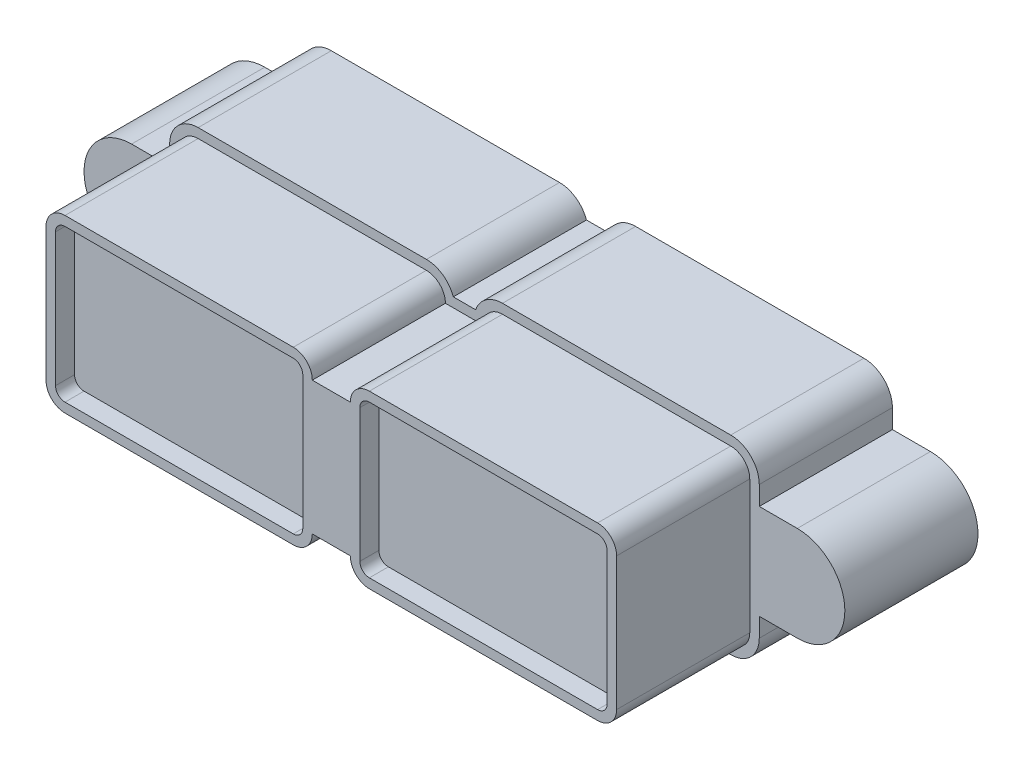
from build123d import *

# Parameters (mm, degrees)
SKETCH1_W           = 45
SKETCH1_H           = 37.5
BOSS_EXTRUDE1_DEPTH = 2
SKETCH2_W           = 40
SKETCH2_H           = 13
BOSS_EXTRUDE2_DEPTH = 7
BOSS_EXTRUDE3_DEPTH = 7
FILLET1_R           = 1
CUT_EXTRUDE1_DEPTH  = 1
SKETCH5_W           = 41
SKETCH5_H           = 14
CUT_EXTRUDE2_DEPTH  = 7
SKETCH6_W           = 11
SKETCH6_H           = 20
BOSS_EXTRUDE5_DEPTH = 12
SKETCH7_W           = 9
SKETCH7_H           = 9
CUT_EXTRUDE3_DEPTH  = 12
SKETCH8_W           = 132.830335996
SKETCH8_H           = 96.675499104
CUT_EXTRUDE4_DEPTH  = 20


with BuildPart() as part:
    # Sketch1 → Boss-Extrude1 (new body)
    with BuildSketch(Plane.XY):
        Rectangle(SKETCH1_W, SKETCH1_H)
    extrude(amount=BOSS_EXTRUDE1_DEPTH)

    # Sketch2 → Boss-Extrude2 (add)
    with BuildSketch(Plane.XY.offset(2)):
        with Locations((0, -11.25)):
            Rectangle(SKETCH2_W, SKETCH2_H)
    extrude(amount=BOSS_EXTRUDE2_DEPTH)

    # Sketch3 → Boss-Extrude3 (add)
    with BuildSketch(Plane.XY.offset(9)):
        Polygon((-1, -7.75), (-1, -6.75), (-15, -6.75), (-15, -15.75), (-1, -15.75), (-1, -14.75), (1, -14.75), (1, -15.75), (15, -15.75), (15, -6.75), (1, -6.75), (1, -7.75), align=None)
    extrude(amount=BOSS_EXTRUDE3_DEPTH)

    # Fillet1
    fillet1_edges = [part.edges().sort_by_distance(p)[0] for p in [
        (-15, -15.75, 12.5),
        (-1, -15.75, 12.5),
        (1, -15.75, 12.5),
        (-15, -6.75, 12.5),
        (15, -15.75, 12.5),
        (15, -6.75, 12.5),
        (1, -6.75, 12.5),
        (-1, -6.75, 12.5),
    ]]
    fillet(fillet1_edges, radius=FILLET1_R - 0.0001)  # a hair under: the kernel refuses the full size

    # Sketch4 → Cut-Extrude1 (cut)
    with BuildSketch(Plane.XY.offset(16)):
        with BuildLine():
            Line((-1.5, -14.75), (-1.5, -7.75))
            ThreePointArc((-1.5, -7.75), (-1.646446609, -7.396446609), (-2, -7.25))
            Line((-2, -7.25), (-14, -7.25))
            ThreePointArc((-14, -7.25), (-14.353553391, -7.396446609), (-14.5, -7.75))
            Line((-14.5, -7.75), (-14.5, -14.75))
            ThreePointArc((-14.5, -14.75), (-14.353553391, -15.103553391), (-14, -15.25))
            Line((-14, -15.25), (-2, -15.25))
            ThreePointArc((-2, -15.25), (-1.646446609, -15.103553391), (-1.5, -14.75))
        make_face()
        with BuildLine():
            Line((1.5, -7.75), (1.5, -14.75))
            ThreePointArc((1.5, -14.75), (1.646446609, -15.103553391), (2, -15.25))
            Line((2, -15.25), (14, -15.25))
            ThreePointArc((14, -15.25), (14.353553391, -15.103553391), (14.5, -14.75))
            Line((14.5, -14.75), (14.5, -7.75))
            ThreePointArc((14.5, -7.75), (14.353553391, -7.396446609), (14, -7.25))
            Line((14, -7.25), (2, -7.25))
            ThreePointArc((2, -7.25), (1.646446609, -7.396446609), (1.5, -7.75))
        make_face()
    extrude(amount=-CUT_EXTRUDE1_DEPTH, mode=Mode.SUBTRACT)

    # Sketch5 → Cut-Extrude2 (cut)
    with BuildSketch(Plane.XY.offset(9)):
        with Locations((0, -11.25)):
            Rectangle(SKETCH5_W, SKETCH5_H)
        with BuildLine():
            Line((-17.5, -8.75), (-15.5, -8.75))
            Line((-15.5, -8.75), (-15.5, -7.75))
            ThreePointArc((-15.5, -7.75), (-15.060660172, -6.689339828), (-14, -6.25))
            Line((-14, -6.25), (-2, -6.25))
            ThreePointArc((-2, -6.25), (-1.133974596, -6.525255129), (-0.585786438, -7.25))
            Line((-0.585786438, -7.25), (0.585786438, -7.25))
            ThreePointArc((0.585786438, -7.25), (1.133974596, -6.525255129), (2, -6.25))
            Line((2, -6.25), (14, -6.25))
            ThreePointArc((14, -6.25), (15.060660172, -6.689339828), (15.5, -7.75))
            Line((15.5, -7.75), (15.5, -8.75))
            Line((15.5, -8.75), (17.5, -8.75))
            ThreePointArc((17.5, -8.75), (20, -11.25), (17.5, -13.75))
            Line((17.5, -13.75), (15.5, -13.75))
            Line((15.5, -13.75), (15.5, -14.75))
            ThreePointArc((15.5, -14.75), (15.060660172, -15.810660172), (14, -16.25))
            Line((14, -16.25), (2, -16.25))
            ThreePointArc((2, -16.25), (1.133974596, -15.974744871), (0.585786438, -15.25))
            Line((0.585786438, -15.25), (-0.585786438, -15.25))
            ThreePointArc((-0.585786438, -15.25), (-1.133974596, -15.974744871), (-2, -16.25))
            Line((-2, -16.25), (-14, -16.25))
            ThreePointArc((-14, -16.25), (-15.060660172, -15.810660172), (-15.5, -14.75))
            Line((-15.5, -14.75), (-15.5, -13.75))
            Line((-15.5, -13.75), (-17.5, -13.75))
            ThreePointArc((-17.5, -13.75), (-20, -11.25), (-17.5, -8.75))
        make_face(mode=Mode.SUBTRACT)
    extrude(amount=-CUT_EXTRUDE2_DEPTH, mode=Mode.SUBTRACT)

    # Sketch6 → Boss-Extrude5 (add)
    with BuildSketch(Plane(origin=(0, 0, 0), x_dir=(-1, 0, 0), z_dir=(0, 0, -1))):
        with Locations((-6, 8.25)):
            Rectangle(SKETCH6_W, SKETCH6_H)
        with Locations((6, 8.25)):
            Rectangle(SKETCH6_W, SKETCH6_H)
    extrude(amount=BOSS_EXTRUDE5_DEPTH)

    # Sketch7 → Cut-Extrude3 (cut)
    with BuildSketch(Plane(origin=(0, 18.25, 0), x_dir=(1, 0, 0), z_dir=(0, 1, 0))):
        with Locations((-6, 5.5)):
            Rectangle(SKETCH7_W, SKETCH7_H)
        with Locations((6, 5.5)):
            Rectangle(SKETCH7_W, SKETCH7_H)
    extrude(amount=-CUT_EXTRUDE3_DEPTH, mode=Mode.SUBTRACT)

    # Sketch8 → Cut-Extrude4 (cut)
    with BuildSketch(Plane.XY.offset(2)):
        Rectangle(SKETCH8_W, SKETCH8_H)
    extrude(amount=-CUT_EXTRUDE4_DEPTH, mode=Mode.SUBTRACT)


solid = part.part
